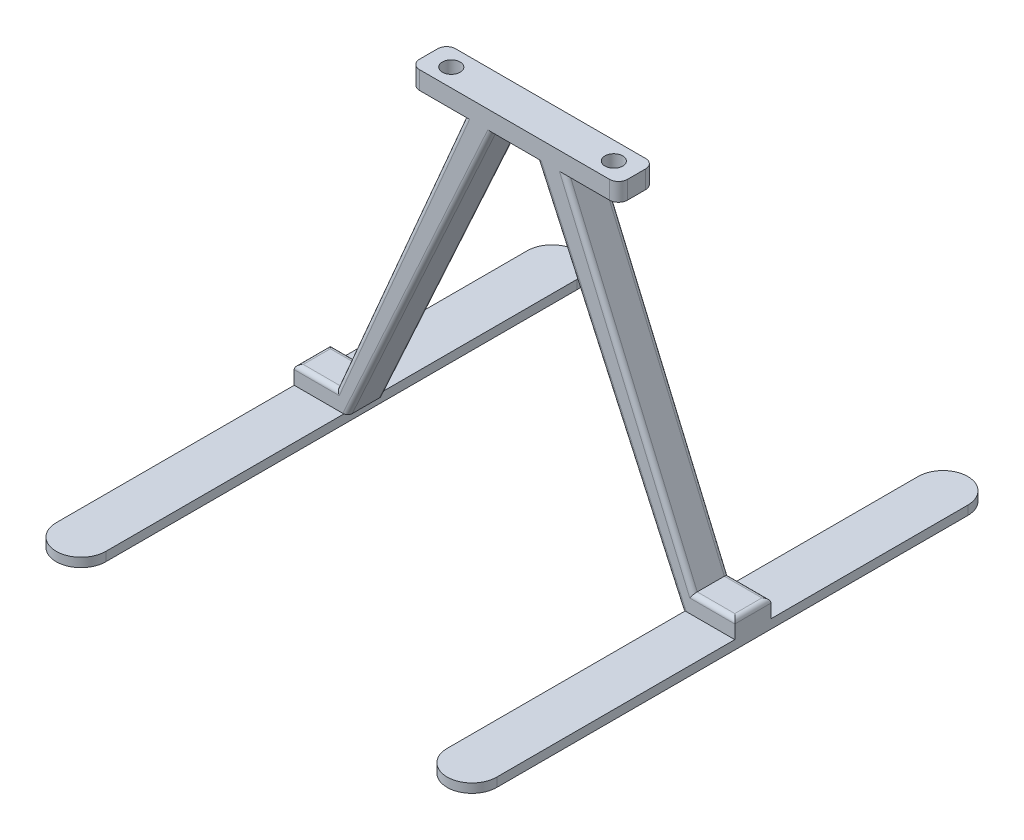
from build123d import *

# Parameters (mm, degrees)
SKETCH1_R           = 2.5
BOSS_EXTRUDE1_DEPTH = 5.08
BOSS_EXTRUDE2_DEPTH = 10.16
FILLET2_R           = 1.27
FILLET3_R           = 1.27
BOSS_EXTRUDE3_DEPTH = 2.54


with BuildPart() as part:
    # Sketch1 → Boss-Extrude1 (new body)
    with BuildSketch(Plane(origin=(0, 0, 0), x_dir=(1, 0, 0), z_dir=(0, 1, 0))):
        with BuildLine():
            Line((26.705849829, 5.08), (-26.705849829, 5.08))
            ThreePointArc((-26.705849829, 5.08), (-28.501901053, 4.336051224), (-29.245849829, 2.54))
            Line((-29.245849829, 2.54), (-29.245849829, -2.54))
            ThreePointArc((-29.245849829, -2.54), (-28.501901053, -4.336051224), (-26.705849829, -5.08))
            Line((-26.705849829, -5.08), (26.705849829, -5.08))
            ThreePointArc((26.705849829, -5.08), (28.501901053, -4.336051224), (29.245849829, -2.54))
            Line((29.245849829, -2.54), (29.245849829, 2.54))
            ThreePointArc((29.245849829, 2.54), (28.501901053, 4.336051224), (26.705849829, 5.08))
        make_face()
        with Locations((-22.86, 0)):
            Circle(SKETCH1_R, mode=Mode.SUBTRACT)
        with Locations((22.86, 0)):
            Circle(SKETCH1_R, mode=Mode.SUBTRACT)
    extrude(amount=BOSS_EXTRUDE1_DEPTH)

    # Sketch2 → Boss-Extrude2 (add)
    with BuildSketch(Plane.XY.offset(5.08)):
        Polygon((-14.007084232, 0), (-50.125026448, -84.328), (-61.947051412, -84.328), (-61.947051412, -89.408), (-50.8, -89.408), (-46.892843325, -89.408), (-6.12233164, 0), align=None)
        Polygon((50.8, -89.408), (61.947051412, -89.408), (61.947051412, -84.328), (50.125026448, -84.328), (14.007084232, 0), (6.12233164, 0), (46.892843325, -89.408), align=None)
    extrude(amount=-BOSS_EXTRUDE2_DEPTH)

    # Fillet2
    fillet2_edges = [part.edges().sort_by_distance(p)[0] for p in [
        (56.03603893, -84.328, -5.08),
        (61.947051412, -84.328, 0),
        (56.03603893, -84.328, 5.08),
        (-56.03603893, -84.328, -5.08),
        (-61.947051412, -84.328, 0),
        (-56.03603893, -84.328, 5.08),
    ]]
    fillet(fillet2_edges, radius=FILLET2_R)

    # Fillet3
    fillet3_edges = [part.edges().sort_by_distance(p)[0] for p in [
        (32.338027797, -42.799, 5.08),
        (26.507587483, -44.704, 5.08),
        (32.338027797, -42.799, -5.08),
        (26.507587483, -44.704, -5.08),
        (-26.507587483, -44.704, -5.08),
        (-32.338027797, -42.799, -5.08),
        (-32.338027797, -42.799, 5.08),
        (-26.507587483, -44.704, 5.08),
    ]]
    fillet(fillet3_edges, radius=FILLET3_R)

    # Sketch3 → Boss-Extrude3 (add)
    with BuildSketch(Plane.XZ.offset(89.408)):
        with BuildLine():
            Line((47.98747777, 72.005934115), (47.98747777, -60.440977769))
            ThreePointArc((47.98747777, -60.440977769), (54.967264591, -67.420764589), (61.947051412, -60.440977769))
            Line((61.947051412, -60.440977769), (61.947051412, 72.005934115))
            ThreePointArc((61.947051412, 72.005934115), (54.967264591, 78.985720936), (47.98747777, 72.005934115))
        make_face()
        with BuildLine():
            Line((-61.947051412, 72.005934115), (-61.947051412, -60.440977769))
            ThreePointArc((-61.947051412, -60.440977769), (-54.967264591, -67.420764589), (-47.98747777, -60.440977769))
            Line((-47.98747777, -60.440977769), (-47.98747777, 72.005934115))
            ThreePointArc((-47.98747777, 72.005934115), (-54.967264591, 78.985720936), (-61.947051412, 72.005934115))
        make_face()
    extrude(amount=BOSS_EXTRUDE3_DEPTH)


solid = part.part
